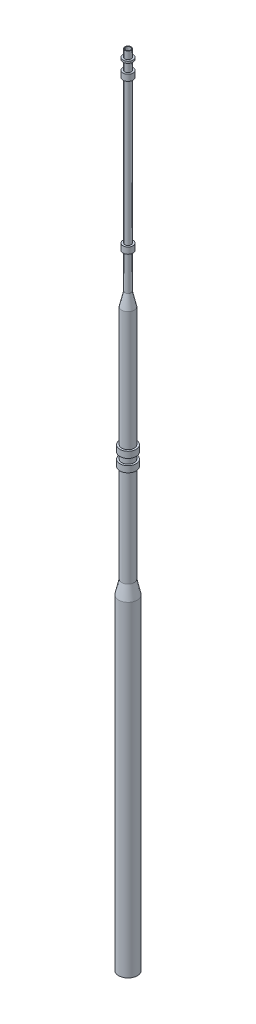
from build123d import *

# Parameters (mm, degrees)
ESQUISSE1_R                  = 5
BOSS_EXTRU_1_DEPTH           = 1280
ESQUISSE2_R                  = 15
BOSS_EXTRU_2_DEPTH           = 500
ESQUISSE3_R                  = 10
BOSS_EXTRU_3_DEPTH           = 400
CHANFREIN1_SIZE              = 10
CHANFREIN1_SIZE_2            = 43.314758743
ENL_V_MAT_EXTRU_1_DEPTH      = 1281.175769182
ENL_V_MAT_EXTRU_1_DEPTH_BACK = 1281.175769182
ESQUISSE4_R                  = 4
ESQUISSE5_R                  = 13
ESQUISSE5_R_2                = 9.409989574
BOSS_EXTRU_4_DEPTH           = 10
ESQUISSE7_R                  = 8
ESQUISSE7_R_2                = 4.592937417
BOSS_EXTRU_5_DEPTH           = 10
ESQUISSE6_R                  = 8
ESQUISSE6_R_2                = 4.579122691
BOSS_EXTRU_6_DEPTH           = 10
BOSS_EXTRU_7_START           = 720
BOSS_EXTRU_7_OUTLINE_R       = 13
BOSS_EXTRU_7_OUTLINE_R_2     = 10
BOSS_EXTRU_7_DEPTH           = 10
ESQUISSE8_R                  = 8
ESQUISSE8_R_2                = 4.5
BOSS_EXTRU_8_DEPTH           = 3


# Read off the part's stored shape, not the designer's step: Boss.-Extru.7
with BuildPart() as part:
    # Esquisse1 → Boss.-Extru.1 (new body)
    with BuildSketch(Plane(origin=(0, 0, 0), x_dir=(1, 0, 0), z_dir=(0, 1, 0))):
        with Locations(Location((0, 0, 0), (0, 0, 270))):
            Circle(ESQUISSE1_R)
    extrude(amount=BOSS_EXTRU_1_DEPTH)

    # Esquisse2 → Boss.-Extru.2 (add)
    with BuildSketch(Plane(origin=(0, 0, 0), x_dir=(1, 0, 0), z_dir=(0, 1, 0))):
        with Locations(Location((0, 0, 0), (0, 0, 270))):
            Circle(ESQUISSE2_R)
    extrude(amount=BOSS_EXTRU_2_DEPTH)

    # Esquisse3 → Boss.-Extru.3 (add)
    with BuildSketch(Plane(origin=(0, 500, 0), x_dir=(1, 0, 0), z_dir=(0, 1, 0))):
        with Locations(Location((0, 0, 0), (0, 0, 270))):
            Circle(ESQUISSE3_R)
    extrude(amount=BOSS_EXTRU_3_DEPTH)

    # Chanfrein1
    # the kernel refuses this chamfer: 43.314758743, 10 mm, written as the material it adds along each edge
    with BuildSketch(Plane(origin=(0, 500, 0), x_dir=(0, 0, 1), z_dir=(-1, 0, 0))) as chanfrein1_piece_1_section:
        Polygon((10 + CHANFREIN1_SIZE, 0), (10, CHANFREIN1_SIZE_2), (10, 0), align=None)
    chanfrein1_piece_1 = revolve(axis=Axis((0, 500, 0), (0, 1, 0)), mode=Mode.PRIVATE)
    chanfrein1_piece_1 = chanfrein1_piece_1 & Plane(origin=(0, 533.274352099, 0), x_dir=(0, 0, 1), z_dir=(0, -1, 0)) * Cylinder(15, 174, mode=Mode.PRIVATE)
    add(chanfrein1_piece_1)
    with BuildSketch(Plane(origin=(0, 900, 0), x_dir=(0, 0, 1), z_dir=(1, 0, 0))) as chanfrein1_piece_2_section:
        Polygon((5 + CHANFREIN1_SIZE, 0), (5, -CHANFREIN1_SIZE_2), (5, 0), align=None)
    chanfrein1_piece_2 = revolve(axis=Axis((0, 900, 0), (0, -1, 0)), mode=Mode.PRIVATE)
    chanfrein1_piece_2 = chanfrein1_piece_2 & Plane(origin=(0, 933.283833366, 0), x_dir=(0, 0, 1), z_dir=(0, -1, 0)) * Cylinder(10, 174, mode=Mode.PRIVATE)
    add(chanfrein1_piece_2)

    # Esquisse4 → Enlèv. mat.-Extru.1 (cut, two sides: drawn at the far end of the back side and taken through both)
    with BuildSketch(Plane(origin=(0, 1280, 0), x_dir=(1, 0, 0), z_dir=(0, 1, 0)).offset(-ENL_V_MAT_EXTRU_1_DEPTH_BACK)):
        with Locations(Location((0, 0, 0), (0, 0, 270))):
            Circle(ESQUISSE4_R)
    extrude(amount=ENL_V_MAT_EXTRU_1_DEPTH + ENL_V_MAT_EXTRU_1_DEPTH_BACK, mode=Mode.SUBTRACT)

    # Esquisse5 → Boss.-Extru.4 (add)
    with BuildSketch(Plane(origin=(0, 700, 0), x_dir=(1, 0, 0), z_dir=(0, 1, 0))):
        with Locations(Location((0, 0, 0), (0, 0, 270))):
            Circle(ESQUISSE5_R)
        Circle(ESQUISSE5_R_2, mode=Mode.SUBTRACT)
    extrude(amount=BOSS_EXTRU_4_DEPTH)

    # Esquisse7 → Boss.-Extru.5 (add)
    with BuildSketch(Plane(origin=(0, 1240, 0), x_dir=(1, 0, 0), z_dir=(0, 1, 0))):
        with Locations(Location((0, 0, 0), (0, 0, 270))):
            Circle(ESQUISSE7_R)
        Circle(ESQUISSE7_R_2, mode=Mode.SUBTRACT)
    extrude(amount=BOSS_EXTRU_5_DEPTH)

    # Esquisse6 → Boss.-Extru.6 (add)
    with BuildSketch(Plane(origin=(0, 1000, 0), x_dir=(1, 0, 0), z_dir=(0, 1, 0))):
        with Locations(Location((0, 0, 0), (0, 0, 270))):
            Circle(ESQUISSE6_R)
        Circle(ESQUISSE6_R_2, mode=Mode.SUBTRACT)
    extrude(amount=BOSS_EXTRU_6_DEPTH)

    # Boss.-Extru.7 outline → Boss.-Extru.7 (add)
    with BuildSketch(Plane(origin=(0, 0, 0), x_dir=(1, 0, 0), z_dir=(0, 1, 0)).offset(BOSS_EXTRU_7_START)):
        Circle(BOSS_EXTRU_7_OUTLINE_R)
        Circle(BOSS_EXTRU_7_OUTLINE_R_2, mode=Mode.SUBTRACT)
    extrude(amount=BOSS_EXTRU_7_DEPTH)

    # Esquisse8 → Boss.-Extru.8 (add)
    with BuildSketch(Plane(origin=(0, 1265, 0), x_dir=(1, 0, 0), z_dir=(0, 1, 0))):
        with Locations(Location((0, 0, 0), (0, 0, 270))):
            Circle(ESQUISSE8_R)
        Circle(ESQUISSE8_R_2, mode=Mode.SUBTRACT)
    extrude(amount=BOSS_EXTRU_8_DEPTH)


solid = part.part
